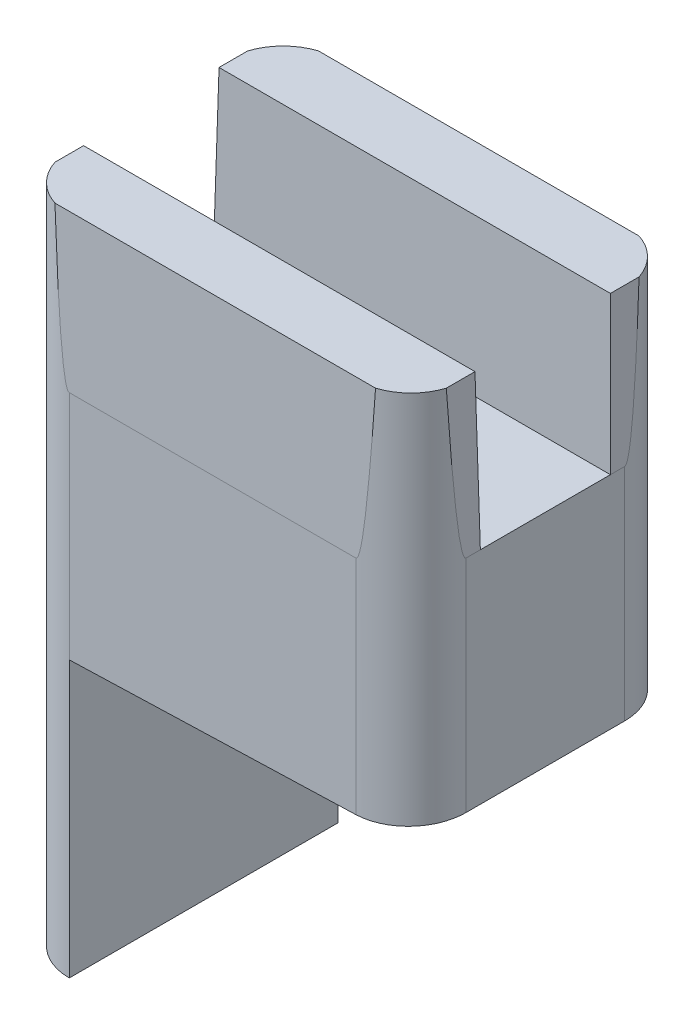
from build123d import *

# Parameters (mm, degrees)
BOSS_EXTRUDE1_DEPTH           = 24.4
SKETCH2_W                     = 36
SKETCH2_H                     = 6.3
BOSS_EXTRUDE2_DEPTH           = 14
BOSS_EXTRUDE2_DRAFT           = 1
BOSS_EXTRUDE2_PROFILE_2_DEPTH = 14
BOSS_EXTRUDE2_PROFILE_2_DRAFT = 1
FILLET1_R                     = 5


with BuildPart() as part:
    # Sketch1 → Boss-Extrude1 (new body)
    with BuildSketch(Plane.XY):
        Polygon((0, 0), (5, 0), (5, 25), (36, 26), (36, 46), (0, 46), align=None)
    extrude(amount=BOSS_EXTRUDE1_DEPTH)


with BuildPart() as boss_extrude2_tool:
    # Sketch2 → Boss-Extrude2 (with draft: the straight prism first)
    with BuildSketch(Plane(origin=(0, 46, 0), x_dir=(1, 0, 0), z_dir=(0, 1, 0))):
        with Locations((18, -3.15)):
            Rectangle(SKETCH2_W, SKETCH2_H)
    extrude(amount=BOSS_EXTRUDE2_DEPTH)
    # Boss-Extrude2: the draft: its side faces are tilted about the plane it starts from
    boss_extrude2_sides = [boss_extrude2_tool.faces().sort_by_distance(p)[0] for p in [
        (0, 53, 3.15),
        (18, 53, 6.3),
        (36, 53, 3.15),
        (18, 53, 0),
    ]]
    draft(boss_extrude2_sides, Plane(origin=(0, 46, 0), x_dir=(1, 0, 0), z_dir=(0, 1, 0)), BOSS_EXTRUDE2_DRAFT)


with BuildPart() as part_1:
    add(part.part)

    # Boss-Extrude2: add boss_extrude2_tool
    add(boss_extrude2_tool.part)


with BuildPart() as boss_extrude2_profile_2_tool:
    # Sketch2 → Boss-Extrude2 profile 2 (with draft: the straight prism first)
    with BuildSketch(Plane(origin=(0, 46, 0), x_dir=(1, 0, 0), z_dir=(0, 1, 0))):
        with Locations((18, -21.25)):
            Rectangle(SKETCH2_W, SKETCH2_H)
    extrude(amount=BOSS_EXTRUDE2_PROFILE_2_DEPTH)
    # Boss-Extrude2 profile 2: the draft: its side faces are tilted about the plane it starts from
    boss_extrude2_profile_2_sides = [boss_extrude2_profile_2_tool.faces().sort_by_distance(p)[0] for p in [
        (18, 53, 24.4),
        (36, 53, 21.25),
        (18, 53, 18.1),
        (0, 53, 21.25),
    ]]
    draft(boss_extrude2_profile_2_sides, Plane(origin=(0, 46, 0), x_dir=(1, 0, 0), z_dir=(0, 1, 0)), BOSS_EXTRUDE2_PROFILE_2_DRAFT)


with BuildPart() as part_2:
    add(part_1.part)

    # Boss-Extrude2 profile 2: add boss_extrude2_profile_2_tool
    add(boss_extrude2_profile_2_tool.part)

    # Fillet1
    # the kernel refuses this fillet: 5 mm, written as the material it takes off along each edge
    with BuildSketch(Plane(origin=(36, -4, 24.4), x_dir=(-1, 0, 0), z_dir=(0, 1, 0))) as fillet1_piece_1:
        with BuildLine():
            CenterArc((FILLET1_R, -FILLET1_R), FILLET1_R, 90, 90)
            Line((0, -FILLET1_R), (-FILLET1_R * 0.02, -FILLET1_R))
            Line((-FILLET1_R * 0.02, -FILLET1_R), (-FILLET1_R * 0.02, FILLET1_R * 0.02))
            Line((-FILLET1_R * 0.02, FILLET1_R * 0.02), (FILLET1_R, FILLET1_R * 0.02))
            Line((FILLET1_R, FILLET1_R * 0.02), (FILLET1_R, 0))
        make_face()
    extrude(amount=80, mode=Mode.SUBTRACT)
    with BuildSketch(Plane(origin=(36, -4, 0), x_dir=(-1, 0, 0), z_dir=(0, 1, 0))) as fillet1_piece_2:
        with BuildLine():
            CenterArc((FILLET1_R, FILLET1_R), FILLET1_R, 180, 90)
            Line((0, FILLET1_R), (-FILLET1_R * 0.02, FILLET1_R))
            Line((-FILLET1_R * 0.02, FILLET1_R), (-FILLET1_R * 0.02, -FILLET1_R * 0.02))
            Line((-FILLET1_R * 0.02, -FILLET1_R * 0.02), (FILLET1_R, -FILLET1_R * 0.02))
            Line((FILLET1_R, -FILLET1_R * 0.02), (FILLET1_R, 0))
        make_face()
    extrude(amount=80, mode=Mode.SUBTRACT)
    with BuildSketch(Plane(origin=(0, 76, 0), x_dir=(0, 0, 1), z_dir=(0, -1, 0))) as fillet1_piece_3:
        with BuildLine():
            CenterArc((FILLET1_R, -FILLET1_R), FILLET1_R, 90, 90)
            Line((0, -FILLET1_R), (-FILLET1_R * 0.02, -FILLET1_R))
            Line((-FILLET1_R * 0.02, -FILLET1_R), (-FILLET1_R * 0.02, FILLET1_R * 0.02))
            Line((-FILLET1_R * 0.02, FILLET1_R * 0.02), (FILLET1_R, FILLET1_R * 0.02))
            Line((FILLET1_R, FILLET1_R * 0.02), (FILLET1_R, 0))
        make_face()
    extrude(amount=106, mode=Mode.SUBTRACT)
    with BuildSketch(Plane(origin=(0, 76, 24.4), x_dir=(0, 0, -1), z_dir=(0, -1, 0))) as fillet1_piece_4:
        with BuildLine():
            CenterArc((FILLET1_R, FILLET1_R), FILLET1_R, 180, 90)
            Line((0, FILLET1_R), (-FILLET1_R * 0.02, FILLET1_R))
            Line((-FILLET1_R * 0.02, FILLET1_R), (-FILLET1_R * 0.02, -FILLET1_R * 0.02))
            Line((-FILLET1_R * 0.02, -FILLET1_R * 0.02), (FILLET1_R, -FILLET1_R * 0.02))
            Line((FILLET1_R, -FILLET1_R * 0.02), (FILLET1_R, 0))
        make_face()
    extrude(amount=106, mode=Mode.SUBTRACT)


solid = part_2.part
